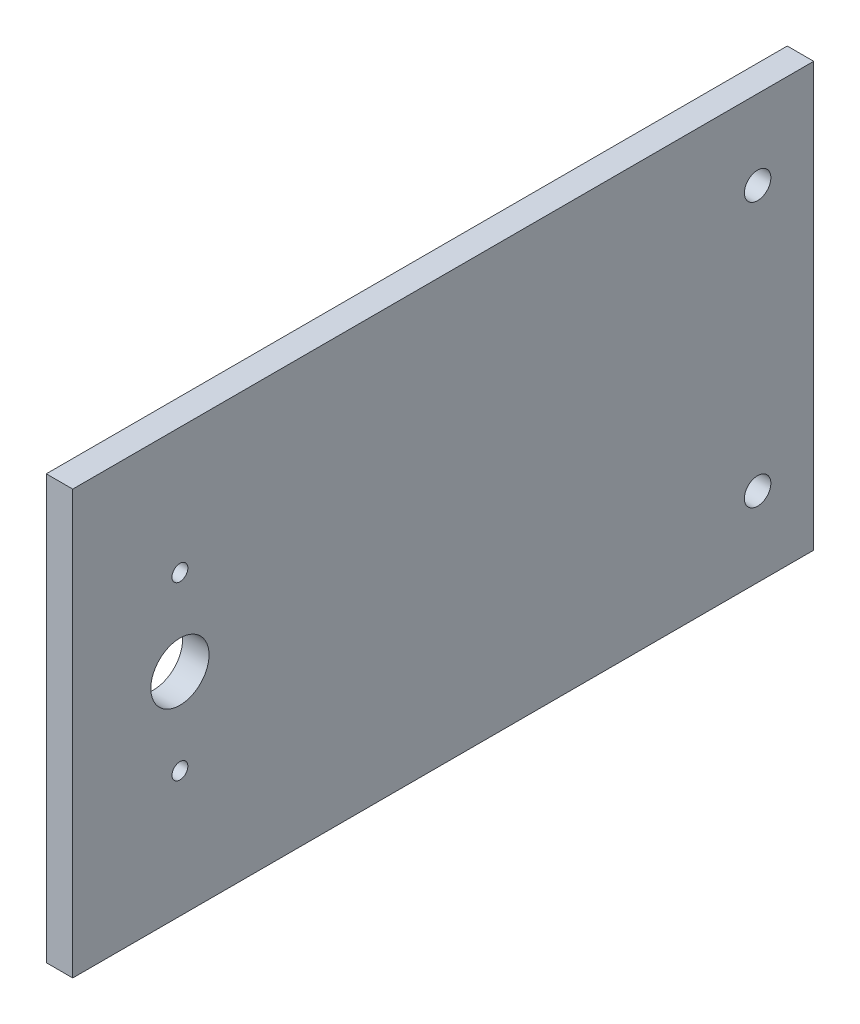
from build123d import *

# Parameters (mm, degrees)
SKETCH1_W           = 80
SKETCH1_H           = 140
SKETCH1_R           = 5.5
SKETCH1_R_2         = 1.5
SKETCH1_R_3         = 2.5
BOSS_EXTRUDE1_DEPTH = 5


with BuildPart() as part:
    # Sketch1 → Boss-Extrude1 (new body)
    with BuildSketch(Plane.YZ):
        Rectangle(SKETCH1_W, SKETCH1_H)
        with Locations((0, 49.75)):
            Circle(SKETCH1_R, mode=Mode.SUBTRACT)
        with Locations((-16.22, 49.75)):
            Circle(SKETCH1_R_2, mode=Mode.SUBTRACT)
        with Locations((16.22, 49.75)):
            Circle(SKETCH1_R_2, mode=Mode.SUBTRACT)
        with Locations((-25, -59.4)):
            Circle(SKETCH1_R_3, mode=Mode.SUBTRACT)
        with Locations((25, -59.4)):
            Circle(SKETCH1_R_3, mode=Mode.SUBTRACT)
    extrude(amount=BOSS_EXTRUDE1_DEPTH)


solid = part.part
